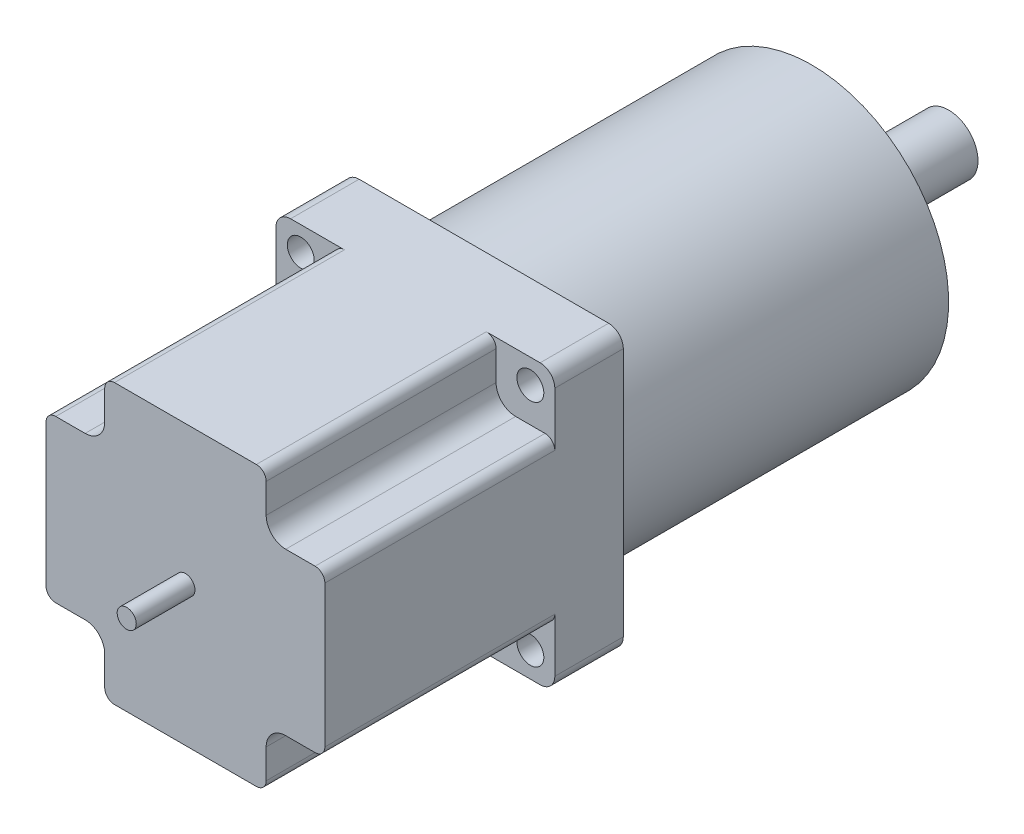
from build123d import *

# Parameters (mm, degrees)
BOSS_EXTRUDE1_DEPTH            = 56
SKETCH2_W                      = 19.654725719
SKETCH2_H                      = 18.883952161
CUT_EXTRUDE1_DEPTH             = 47
FILLET1_R                      = 2
FILLET2_R                      = 4
M5_CLEARANCE_HOLE2_D           = 5.5
M5_CLEARANCE_HOLE2_CSINK_D     = 5.55
M5_CLEARANCE_HOLE2_CSINK_ANGLE = 90
SKETCH6_R                      = 1.95
BOSS_EXTRUDE2_DEPTH            = 12
BOSS_EXTRUDE3_START            = 5
BOSS_EXTRUDE3_DEPTH            = 5
SKETCH8_R                      = 28
BOSS_EXTRUDE4_DEPTH            = 67
SKETCH9_R                      = 16
BOSS_EXTRUDE5_DEPTH            = 2
CIRPATTERN1_COUNT              = 4
SKETCH14_R                     = 6
BOSS_EXTRUDE6_DEPTH            = 26


with BuildPart() as part:
    # Sketch1 → Boss-Extrude1 (new body)
    with BuildSketch(Plane.XY):
        with BuildLine():
            Line((-3, 0), (-54, 0))
            ThreePointArc((-54, 0), (-56.121320344, -0.878679656), (-57, -3))
            Line((-57, -3), (-57, -54))
            ThreePointArc((-57, -54), (-56.121320344, -56.121320344), (-54, -57))
            Line((-54, -57), (-3, -57))
            ThreePointArc((-3, -57), (-0.878679656, -56.121320344), (0, -54))
            Line((0, -54), (0, -3))
            ThreePointArc((0, -3), (-0.878679656, -0.878679656), (-3, 0))
        make_face()
    extrude(amount=BOSS_EXTRUDE1_DEPTH)

    # Sketch2 → Cut-Extrude1 (cut)
    with BuildSketch(Plane.XY.offset(56)):
        with Locations((-54.827362859, -2.558023919)):
            Rectangle(SKETCH2_W, SKETCH2_H)
        with Locations((-2.17263714, -2.558023919)):
            Rectangle(SKETCH2_W, SKETCH2_H)
        with Locations((-2.17263714, -54.44197608)):
            Rectangle(SKETCH2_W, SKETCH2_H)
        with Locations((-54.827362859, -54.44197608)):
            Rectangle(SKETCH2_W, SKETCH2_H)
    extrude(amount=-CUT_EXTRUDE1_DEPTH, mode=Mode.SUBTRACT)

    # Fillet1
    fillet1_edges = [part.edges().sort_by_distance(p)[0] for p in [
        (-57, -45, 32.5),
        (-45, -57, 32.5),
        (-12, -57, 32.5),
        (0, -45, 32.5),
        (0, -12, 32.5),
        (-12, 0, 32.5),
        (-57, -12, 32.5),
        (-45, 0, 32.5),
    ]]
    fillet(fillet1_edges, radius=FILLET1_R)

    # Fillet2
    fillet2_edges = [part.edges().sort_by_distance(p)[0] for p in [
        (-45, -12, 32.5),
        (-45, -45, 32.5),
        (-12, -45, 32.5),
        (-12, -12, 32.5),
    ]]
    fillet(fillet2_edges, radius=FILLET2_R)

    # M5 Clearance Hole2 (through all)
    with Locations(Plane(origin=(0, 0, 0), x_dir=(-1, 0, 0), z_dir=(0, 0, -1))):
        with Locations((51.921563773, -4.957706516), (4.997949753, -4.957706516), (4.997949753, -51.800834063), (51.921563773, -52.283752904)):
            CounterSinkHole(M5_CLEARANCE_HOLE2_D / 2, M5_CLEARANCE_HOLE2_CSINK_D / 2, counter_sink_angle=M5_CLEARANCE_HOLE2_CSINK_ANGLE)

    # Sketch6 → Boss-Extrude2 (add)
    with BuildSketch(Plane.XY.offset(56)):
        with Locations((-28.5, -28.5)):
            Circle(SKETCH6_R)
    extrude(amount=BOSS_EXTRUDE2_DEPTH)

    # Sketch7 → Boss-Extrude3 (add)
    with BuildSketch(Plane(origin=(0, 0, 0), x_dir=(-1, 0, 0), z_dir=(0, 0, -1)).offset(BOSS_EXTRUDE3_START)):
        with BuildLine():
            Line((57, -54), (57, -3))
            ThreePointArc((57, -3), (56.121320344, -0.878679656), (54, 0))
            Line((54, 0), (3, 0))
            ThreePointArc((3, 0), (0.878679656, -0.878679656), (0, -3))
            Line((0, -3), (0, -54))
            ThreePointArc((0, -54), (0.878679656, -56.121320344), (3, -57))
            Line((3, -57), (54, -57))
            ThreePointArc((54, -57), (56.121320344, -56.121320344), (57, -54))
        make_face()
    extrude(amount=-BOSS_EXTRUDE3_DEPTH)

    # Sketch8 → Boss-Extrude4 (add)
    with BuildSketch(Plane(origin=(0, 0, -5), x_dir=(-1, 0, 0), z_dir=(0, 0, -1))):
        with Locations((28.5, -28.5)):
            Circle(SKETCH8_R)
    extrude(amount=BOSS_EXTRUDE4_DEPTH)

    # Sketch9 → Boss-Extrude5 (add)
    with BuildSketch(Plane(origin=(0, 0, -72), x_dir=(-1, 0, 0), z_dir=(0, 0, -1))):
        with Locations((28.5, -28.5)):
            Circle(SKETCH9_R)
    extrude(amount=BOSS_EXTRUDE5_DEPTH)

    # Sketch13 → M5 Clearance Hole1 (revolve, cut)
    with BuildSketch(Plane(origin=(-44.409902577, -12.590097423, -72), x_dir=(0, 1, 0), z_dir=(1, 0, 0))):
        Polygon((0, 0), (0, 21.652366702), (2.75, 20), (2.75, 0.025), (2.775, 0), align=None)
    m5_clearance_hole1 = revolve(axis=Axis((-44.409902577, -12.590097423, -78.35), (0, 0, 1)), mode=Mode.SUBTRACT)

    # CirPattern1: M5 Clearance Hole1 ×4 about axis
    cirpattern1_axis = Axis((-28.5, -28.5, -72), (0, 0, -1))
    for i in range(1, CIRPATTERN1_COUNT):
        add(m5_clearance_hole1.rotate(cirpattern1_axis, i * 360 / CIRPATTERN1_COUNT), mode=Mode.SUBTRACT)

    # Sketch14 → Boss-Extrude6 (add)
    with BuildSketch(Plane(origin=(0, 0, -74), x_dir=(-1, 0, 0), z_dir=(0, 0, -1))):
        with Locations((28.5, -28.5)):
            Circle(SKETCH14_R)
    extrude(amount=BOSS_EXTRUDE6_DEPTH)


solid = part.part
